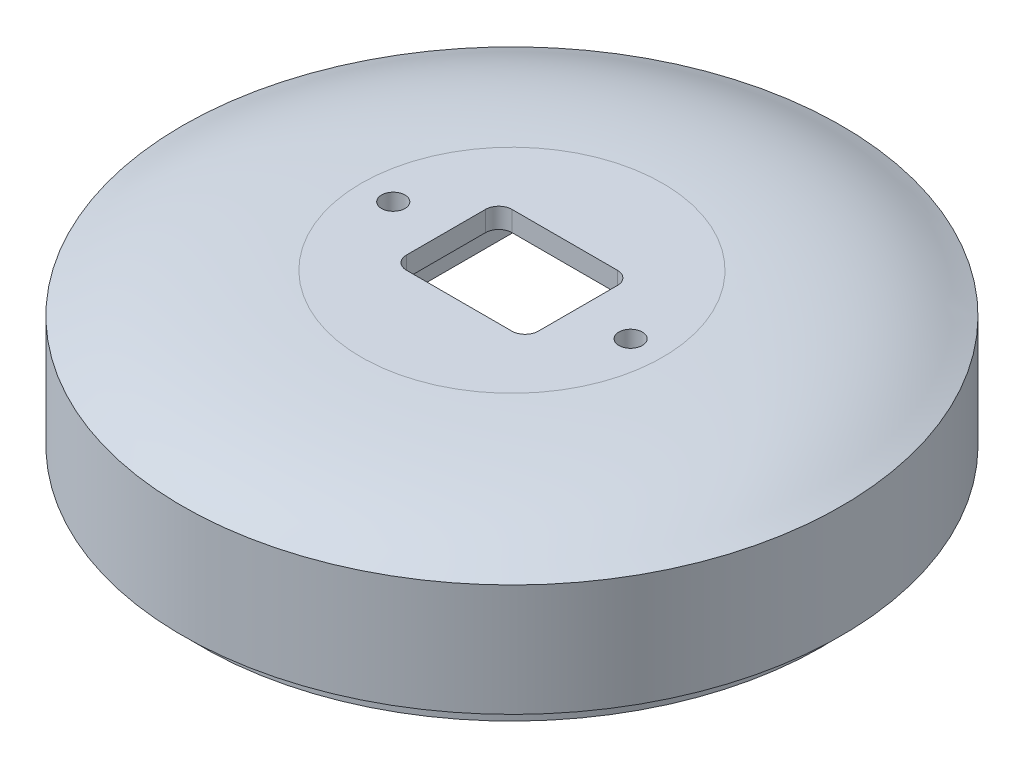
from build123d import *

# Parameters (mm, degrees)
ENL_V_MAT_EXTRU_3_DEPTH                          = 11.5
CHAMBRAGE_POUR_VIS_T_TE_RONDE_BOMB_E_D           = 1.778
CHAMBRAGE_POUR_VIS_T_TE_RONDE_BOMB_E_CBORE_D     = 3.57124
CHAMBRAGE_POUR_VIS_T_TE_RONDE_BOMB_E_CBORE_DEPTH = 0.254
CHAMBRAGE_POUR_VIS_T_TE_RONDE_BOMB_2_D           = 1.778
CHAMBRAGE_POUR_VIS_T_TE_RONDE_BOMB_2_CBORE_D     = 3.57124
CHAMBRAGE_POUR_VIS_T_TE_RONDE_BOMB_2_CBORE_DEPTH = 0.254
BOSS_EXTRU_19_DEPTH                              = 10


with BuildPart() as part:
    # Esquisse2 → Révolution9 (revolve)
    with BuildSketch(Plane.XY):
        with BuildLine():
            Line((0, 0), (-11.429433594, 0))
            add(Edge.make_bspline(
                [(-11.429433594, 0), (-18.018079442, -0.177631597), (-21.527545087, -1.256558996), (-24.458910549, -2.761373187), (-24.994650985, -3)],
                knots=[0, 0, 0, 0, 0.820152053, 1, 1, 1, 1], degree=3))
            Line((-24.994650985, -3), (-24.994650985, -11.5))
            Line((-24.994650985, -11.5), (-22.994650985, -11.5))
            Line((-22.994650985, -11.5), (-22.994650985, -12.5))
            Line((-22.994650985, -12.5), (-23.494650985, -12.5))
            Line((-23.494650985, -12.5), (-23.494650985, -13))
            Line((-23.494650985, -13), (-21.994650985, -13))
            Line((-21.994650985, -13), (-21.994650985, -10.5))
            Line((-21.994650985, -10.5), (-23.494650985, -10.5))
            Line((-23.494650985, -10.5), (-23.494650985, -3.661402138))
            Line((-23.494650985, -3.661402138), (-11.948268975, -1.527527751))
            Line((-11.948268975, -1.527527751), (0, -1.527527751))
            Line((0, -1.527527751), (0, 0))
        make_face()
    revolve(axis=Axis((0, 0, 0), (0, -1, 0)))

    # Esquisse4 → Enlèv. mat.-Extru.3 (cut)
    with BuildSketch(Plane(origin=(0, 0, 0), x_dir=(1, 0, 0), z_dir=(0, 1, 0))):
        with BuildLine():
            Line((4, -4), (-4, -4))
            ThreePointArc((-4, -4), (-4.707106781, -3.707106781), (-5, -3))
            Line((-5, -3), (-5, 3))
            ThreePointArc((-5, 3), (-4.707106781, 3.707106781), (-4, 4))
            Line((-4, 4), (4, 4))
            ThreePointArc((4, 4), (4.707106781, 3.707106781), (5, 3))
            Line((5, 3), (5, -3))
            ThreePointArc((5, -3), (4.707106781, -3.707106781), (4, -4))
        make_face()
    extrude(amount=-ENL_V_MAT_EXTRU_3_DEPTH, mode=Mode.SUBTRACT)

    # Chambrage pour vis _ t_te ronde bomb_e (through all)
    with Locations(Plane(origin=(0, -1.527527751, 0), x_dir=(-1, 0, 0), z_dir=(0, -1, 0))):
        with Locations((-9, 0)):
            CounterBoreHole(CHAMBRAGE_POUR_VIS_T_TE_RONDE_BOMB_E_D / 2, CHAMBRAGE_POUR_VIS_T_TE_RONDE_BOMB_E_CBORE_D / 2, CHAMBRAGE_POUR_VIS_T_TE_RONDE_BOMB_E_CBORE_DEPTH)

    # Chambrage pour vis _ t_te ronde bomb 2 (through all)
    with Locations(Plane(origin=(0, -1.527527751, 0), x_dir=(-1, 0, 0), z_dir=(0, -1, 0))):
        with Locations((9, 0)):
            CounterBoreHole(CHAMBRAGE_POUR_VIS_T_TE_RONDE_BOMB_2_D / 2, CHAMBRAGE_POUR_VIS_T_TE_RONDE_BOMB_2_CBORE_D / 2, CHAMBRAGE_POUR_VIS_T_TE_RONDE_BOMB_2_CBORE_DEPTH)

    # Esquisse3D1 → Boss.-Extru.19 (add)
    with BuildSketch(Plane(origin=(14.072290368, -11.5, -14.427035696), x_dir=(-0.7071067811865475, 0, 0.7071067811865476), z_dir=(0, 1, 0))):
        Polygon((-1.414213562, 0), (19.798989873, 21.213203436), (41.012193309, 0), (19.798989873, -21.213203436), align=None)
        Polygon((0, 0), (19.798989873, -19.798989873), (39.597979746, 0), (19.798989873, 19.798989873), align=None, mode=Mode.SUBTRACT)
    extrude(amount=BOSS_EXTRU_19_DEPTH)


solid = part.part
